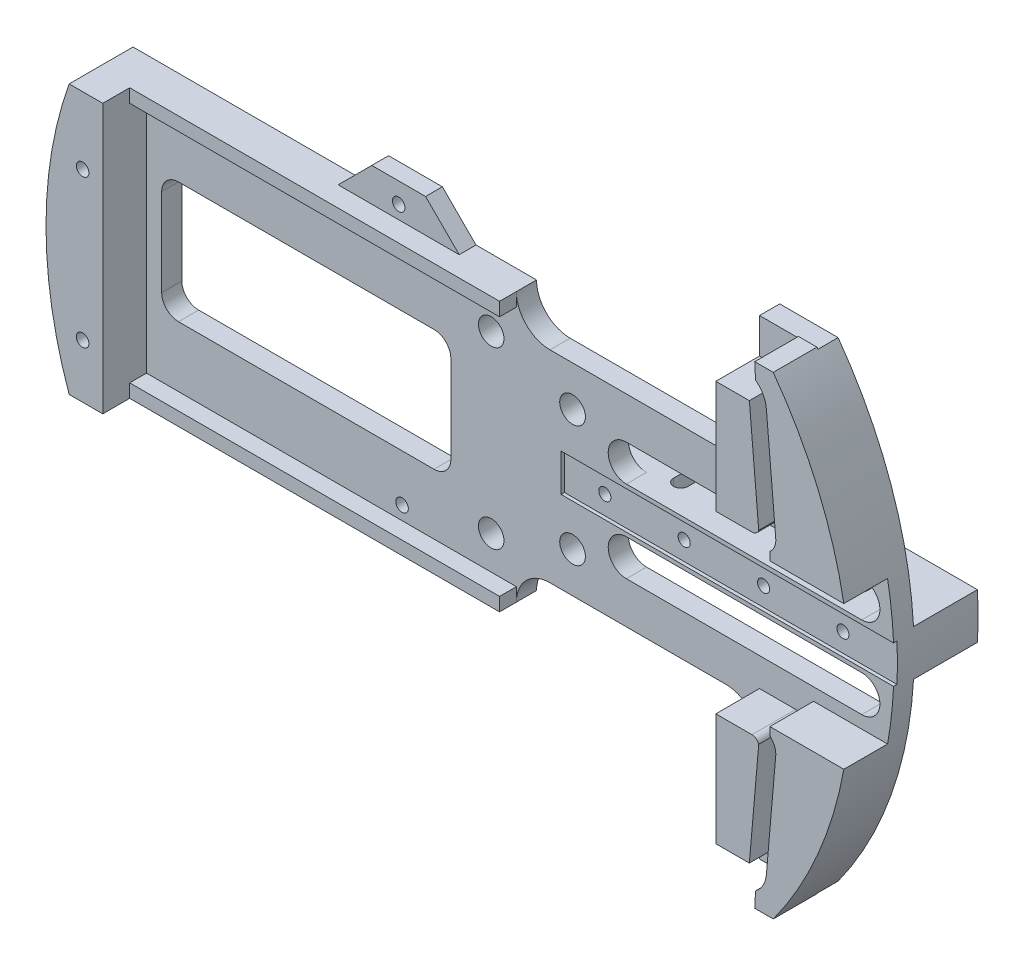
from build123d import *

# Parameters (mm, degrees)
BOSS_EXTRUDE1_DEPTH     = 3.81
BOSS_EXTRUDE2_DEPTH     = 8.255
SKETCH3_W               = 63.5
SKETCH3_H               = 7.1
CUT_EXTRUDE1_DEPTH      = 0.635
CUT_EXTRUDE4_DEPTH      = 89.512075769
CUT_EXTRUDE5_DEPTH      = 89.512075769
SKETCH12_R              = 2.4257
CUT_EXTRUDE6_DEPTH      = 89.512075769
BOSS_EXTRUDE3_START     = 12.065
BOSS_EXTRUDE3_DEPTH     = 12.065
SKETCH4_R               = 1.143
CUT_EXTRUDE2_DEPTH      = 11.43
CUT_EXTRUDE7_DEPTH      = 92.191706843
CUT_EXTRUDE8_DEPTH      = 92.191706843
CUT_EXTRUDE8_DEPTH_BACK = 92.191706843
SKETCH17_R              = 2.413
CUT_EXTRUDE9_DEPTH      = 90.544727131
BOSS_EXTRUDE5_DEPTH     = 8.255
SKETCH20_W              = 69.85
SKETCH20_H              = 3.175
BOSS_EXTRUDE6_DEPTH     = 2.54
BOSS_EXTRUDE7_DEPTH     = 3.175
SKETCH22_R              = 1.18745
CUT_EXTRUDE10_DEPTH     = 89.948337573


with BuildPart() as part:
    # Sketch1 → Boss-Extrude1 (new body)
    with BuildSketch(Plane.XY):
        with BuildLine():
            Line((10.977415053, 19.05), (44.196, 19.05))
            ThreePointArc((44.196, 19.05), (48.686128061, 20.909871939), (50.546, 25.4))
            Line((50.546, 25.4), (50.546, 44.45))
            Line((50.546, 44.45), (61.579155694, 44.45))
            ThreePointArc((61.579155694, 44.45), (75.946, 0), (61.579155694, -44.45))
            Line((61.579155694, -44.45), (50.546, -44.45))
            Line((50.546, -44.45), (50.546, -25.4))
            ThreePointArc((50.546, -25.4), (48.686128061, -20.909871939), (44.196, -19.05))
            Line((44.196, -19.05), (10.977415053, -19.05))
            ThreePointArc((10.977415053, -19.05), (6.487286992, -20.909871939), (4.627415053, -25.4))
            Line((4.627415053, -25.4), (-71.572584947, -25.4))
            ThreePointArc((-71.572584947, -25.4), (-75.946, 0), (-71.572584947, 25.4))
            Line((-71.572584947, 25.4), (4.627415053, 25.4))
            ThreePointArc((4.627415053, 25.4), (6.487286992, 20.909871939), (10.977415053, 19.05))
        make_face()
    extrude(amount=BOSS_EXTRUDE1_DEPTH)

    # Sketch2 → Boss-Extrude2 (add)
    with BuildSketch(Plane.XY.offset(3.81)):
        with BuildLine():
            Line((61.865268471, 17.78), (60.095110466, 38.1))
            ThreePointArc((60.095110466, 38.1), (59.464196764, 40.158289632), (58.047089349, 41.778911391))
            Line((58.047089349, 41.778911391), (57.900800643, 44.704))
            Line((57.900800643, 44.704), (61.395010384, 44.704))
            ThreePointArc((61.395010384, 44.704), (69.822038137, 29.877715884), (74.728381149, 13.544887112))
            Line((74.728381149, 13.544887112), (60.759450402, 13.544887112))
            Line((60.759450402, 13.544887112), (60.759450402, 15.094127876))
            ThreePointArc((60.759450402, 15.094127876), (61.639191639, 16.302501703), (61.865268471, 17.78))
        make_face()
        with BuildLine():
            Line((58.651639318, 17.500047669), (56.881481313, 37.820047669))
            Line((56.881481313, 37.820047669), (50.546, 37.820047669))
            Line((50.546, 37.820047669), (50.546, 16.566735288))
            Line((50.546, 16.566735288), (57.366094516, 16.566735288))
            ThreePointArc((57.366094516, 16.566735288), (58.160401987, 16.824667019), (58.651639318, 17.500047669))
        make_face()
        with BuildLine():
            Line((60.759450402, -13.544887112), (74.728381149, -13.544887112))
            ThreePointArc((74.728381149, -13.544887112), (69.822038137, -29.877715884), (61.395010384, -44.704))
            Line((61.395010384, -44.704), (57.900800643, -44.704))
            Line((57.900800643, -44.704), (58.047089349, -41.778911391))
            ThreePointArc((58.047089349, -41.778911391), (59.464196764, -40.158289632), (60.095110466, -38.1))
            Line((60.095110466, -38.1), (61.865268471, -17.78))
            ThreePointArc((61.865268471, -17.78), (61.639191639, -16.302501703), (60.759450402, -15.094127876))
            Line((60.759450402, -15.094127876), (60.759450402, -13.544887112))
        make_face()
        with BuildLine():
            Line((50.546, -16.566735288), (57.366094516, -16.566735288))
            ThreePointArc((57.366094516, -16.566735288), (58.160401987, -16.824667019), (58.651639318, -17.500047669))
            Line((58.651639318, -17.500047669), (56.881481313, -37.820047669))
            Line((56.881481313, -37.820047669), (50.546, -37.820047669))
            Line((50.546, -37.820047669), (50.546, -16.566735288))
        make_face()
    extrude(amount=BOSS_EXTRUDE2_DEPTH)

    # Sketch3 → Cut-Extrude1 (cut)
    with BuildSketch(Plane.XY.offset(3.81)):
        with Locations((44.831, 0)):
            Rectangle(SKETCH3_W, SKETCH3_H)
    extrude(amount=-CUT_EXTRUDE1_DEPTH, mode=Mode.SUBTRACT)

    # Sketch9 → Cut-Extrude4 (cut, through all)
    with BuildSketch(Plane.XY.offset(3.81)):
        with BuildLine():
            Line((69.85, 11.17), (25.4, 11.17))
            ThreePointArc((25.4, 11.17), (21.971, 7.741), (25.4, 4.312))
            Line((25.4, 4.312), (69.85, 4.312))
            ThreePointArc((69.85, 4.312), (73.279, 7.741), (69.85, 11.17))
        make_face()
        with BuildLine():
            Line((69.85, -4.312), (25.4, -4.312))
            ThreePointArc((25.4, -4.312), (21.971, -7.741), (25.4, -11.17))
            Line((25.4, -11.17), (69.85, -11.17))
            ThreePointArc((69.85, -11.17), (73.279, -7.741), (69.85, -4.312))
        make_face()
    extrude(amount=-CUT_EXTRUDE4_DEPTH, mode=Mode.SUBTRACT)

    # Sketch10 → Cut-Extrude5 (cut, through all)
    with BuildSketch(Plane.XY.offset(3.81)):
        with BuildLine():
            Line((-10.922, 11.43), (-59.182, 11.43))
            ThreePointArc((-59.182, 11.43), (-61.42706403, 10.50006403), (-62.357, 8.255))
            Line((-62.357, 8.255), (-62.357, -8.255))
            ThreePointArc((-62.357, -8.255), (-61.42706403, -10.50006403), (-59.182, -11.43))
            Line((-59.182, -11.43), (-10.922, -11.43))
            ThreePointArc((-10.922, -11.43), (-8.67693597, -10.50006403), (-7.747, -8.255))
            Line((-7.747, -8.255), (-7.747, 8.255))
            ThreePointArc((-7.747, 8.255), (-8.67693597, 10.50006403), (-10.922, 11.43))
        make_face()
    extrude(amount=-CUT_EXTRUDE5_DEPTH, mode=Mode.SUBTRACT)

    # Sketch12 → Cut-Extrude6 (cut, through all)
    with BuildSketch(Plane.XY.offset(3.81)):
        with Locations((15.24, 11.43)):
            Circle(SKETCH12_R)
        with Locations((15.24, -11.43)):
            Circle(SKETCH12_R)
    extrude(amount=-CUT_EXTRUDE6_DEPTH, mode=Mode.SUBTRACT)

    # Sketch14 → Boss-Extrude3 (add)
    with BuildSketch(Plane(origin=(0, 0, 0), x_dir=(-1, 0, 0), z_dir=(0, 0, -1)).offset(BOSS_EXTRUDE3_START)):
        with BuildLine():
            Line((-75.823489579, 4.312), (7.747, 4.312))
            Line((7.747, 4.312), (7.747, -4.312))
            Line((7.747, -4.312), (-75.823489579, -4.312))
            ThreePointArc((-75.823489579, -4.312), (-75.946, 0), (-75.823489579, 4.312))
        make_face()
    extrude(amount=-BOSS_EXTRUDE3_DEPTH)

    # Sketch4 → Cut-Extrude2 (cut)
    with BuildSketch(Plane.XY.offset(3.175)):
        with Locations((20.701, 0)):
            Circle(SKETCH4_R)
        with Locations((35.687, 0)):
            Circle(SKETCH4_R)
        with Locations((50.673, 0)):
            Circle(SKETCH4_R)
        with Locations((65.659, 0)):
            Circle(SKETCH4_R)
    extrude(amount=-CUT_EXTRUDE2_DEPTH, mode=Mode.SUBTRACT)

    # Sketch15 → Cut-Extrude7 (cut, through all)
    with BuildSketch(Plane(origin=(0, 4.312, 0), x_dir=(1, 0, 0), z_dir=(0, 1, 0))):
        with BuildLine():
            Line((28.8925, 1.615666853), (28.8925, 5.933666853))
            ThreePointArc((28.8925, 5.933666853), (30.2514, 7.292566853), (31.6103, 5.933666853))
            Line((31.6103, 5.933666853), (31.6103, 1.615666853))
            ThreePointArc((31.6103, 1.615666853), (30.2514, 0.256766853), (28.8925, 1.615666853))
        make_face()
        with BuildLine():
            Line((41.1099, 1.615666853), (41.1099, 5.933666853))
            ThreePointArc((41.1099, 5.933666853), (39.751, 7.292566853), (38.3921, 5.933666853))
            Line((38.3921, 5.933666853), (38.3921, 1.615666853))
            ThreePointArc((38.3921, 1.615666853), (39.751, 0.256766853), (41.1099, 1.615666853))
        make_face()
        with BuildLine():
            Line((65.5955, 1.615666853), (65.5955, 5.933666853))
            ThreePointArc((65.5955, 5.933666853), (64.2366, 7.292566853), (62.8777, 5.933666853))
            Line((62.8777, 5.933666853), (62.8777, 1.615666853))
            ThreePointArc((62.8777, 1.615666853), (64.2366, 0.256766853), (65.5955, 1.615666853))
        make_face()
        with BuildLine():
            Line((56.0959, 1.615666853), (56.0959, 5.933666853))
            ThreePointArc((56.0959, 5.933666853), (54.737, 7.292566853), (53.3781, 5.933666853))
            Line((53.3781, 5.933666853), (53.3781, 1.615666853))
            ThreePointArc((53.3781, 1.615666853), (54.737, 0.256766853), (56.0959, 1.615666853))
        make_face()
    extrude(amount=-CUT_EXTRUDE7_DEPTH, mode=Mode.SUBTRACT)

    # Sketch16 → Cut-Extrude8 (cut, two sides: drawn at the far end of the back side and taken through both)
    with BuildSketch(Plane.XZ.offset(4.312).offset(-CUT_EXTRUDE8_DEPTH_BACK)):
        with BuildLine():
            Line((4.627415053, 0), (-7.747, 0))
            Line((-7.747, 0), (-7.747, -12.065))
            Line((-7.747, -12.065), (0, -12.065))
            Line((0, -12.065), (22.547469063, -12.065))
            ThreePointArc((22.547469063, -12.065), (14.291875083, -4.986210911), (4.627415053, 0))
        make_face()
    extrude(amount=CUT_EXTRUDE8_DEPTH + CUT_EXTRUDE8_DEPTH_BACK, mode=Mode.SUBTRACT)

    # Sketch17 → Cut-Extrude9 (cut, through all)
    with BuildSketch(Plane.XY.offset(3.81)):
        with Locations((-0.127, 16.51)):
            Circle(SKETCH17_R)
        with Locations((-0.127, -16.51)):
            Circle(SKETCH17_R)
    extrude(amount=-CUT_EXTRUDE9_DEPTH, mode=Mode.SUBTRACT)

    # Sketch19 → Boss-Extrude5 (add)
    with BuildSketch(Plane.XY.offset(3.81)):
        with BuildLine():
            Line((-71.572584947, -25.4), (-65.222584947, -25.4))
            Line((-65.222584947, -25.4), (-65.222584947, 25.4))
            Line((-65.222584947, 25.4), (-71.572584947, 25.4))
            ThreePointArc((-71.572584947, 25.4), (-75.946, 0), (-71.572584947, -25.4))
        make_face()
    extrude(amount=BOSS_EXTRUDE5_DEPTH)

    # Sketch20 → Boss-Extrude6 (add)
    with BuildSketch(Plane.XZ.offset(25.4)):
        with Locations((-30.297584947, 5.3975)):
            Rectangle(SKETCH20_W, SKETCH20_H)
    boss_extrude6 = extrude(amount=-BOSS_EXTRUDE6_DEPTH)

    # Mirror1: Boss-Extrude6 across plane
    add(boss_extrude6.mirror(Plane.ZX))

    # Sketch21 → Boss-Extrude7 (add)
    with BuildSketch(Plane(origin=(0, 0, 0), x_dir=(-1, 0, 0), z_dir=(0, 0, -1))):
        Polygon((6.802584947, 25.4), (13.152584947, 31.75), (23.312584947, 31.75), (29.662584947, 25.4), align=None)
    extrude(amount=-BOSS_EXTRUDE7_DEPTH)

    # Sketch22 → Cut-Extrude10 (cut, through all)
    with BuildSketch(Plane(origin=(0, 0, 0), x_dir=(-1, 0, 0), z_dir=(0, 0, -1))):
        with Locations((18.232584947, 27.94)):
            Circle(SKETCH22_R)
        with Locations((16.962584947, -20.30328658)):
            Circle(SKETCH22_R)
        with Locations((69.032584947, 12.7)):
            Circle(SKETCH22_R)
        with Locations((69.032584947, -15.24)):
            Circle(SKETCH22_R)
    extrude(amount=-CUT_EXTRUDE10_DEPTH, mode=Mode.SUBTRACT)


solid = part.part
